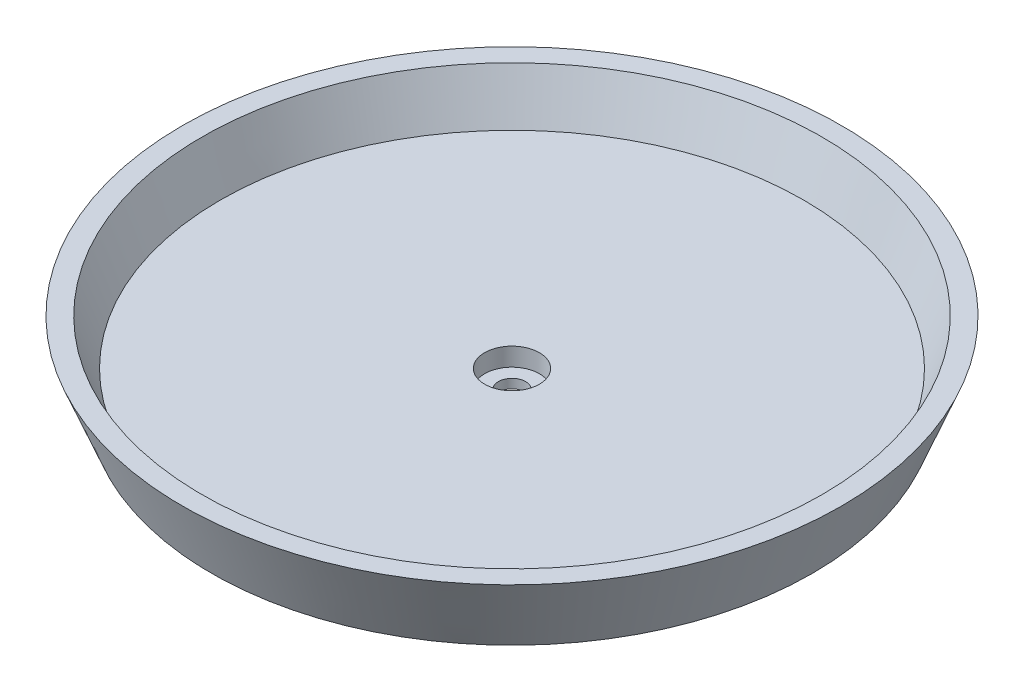
from build123d import *


with BuildPart() as part:
    # 草图1 → 旋转1 (revolve)
    with BuildSketch(Plane.XY):
        Polygon((-48.577397163, 8.47616959), (-50.577397163, 13.47616959), (-52.731463086, 13.47616959), (-49.531463086, 5.47616959), (-18.077397163, 5.47616959), (-18.077397163, 6.47616959), (-19.577397163, 6.47616959), (-19.577397163, 8.47616959), align=None)
    revolve(axis=Axis((-16.577397163, 5.47616959, 0), (0, 1, 0)))


solid = part.part
